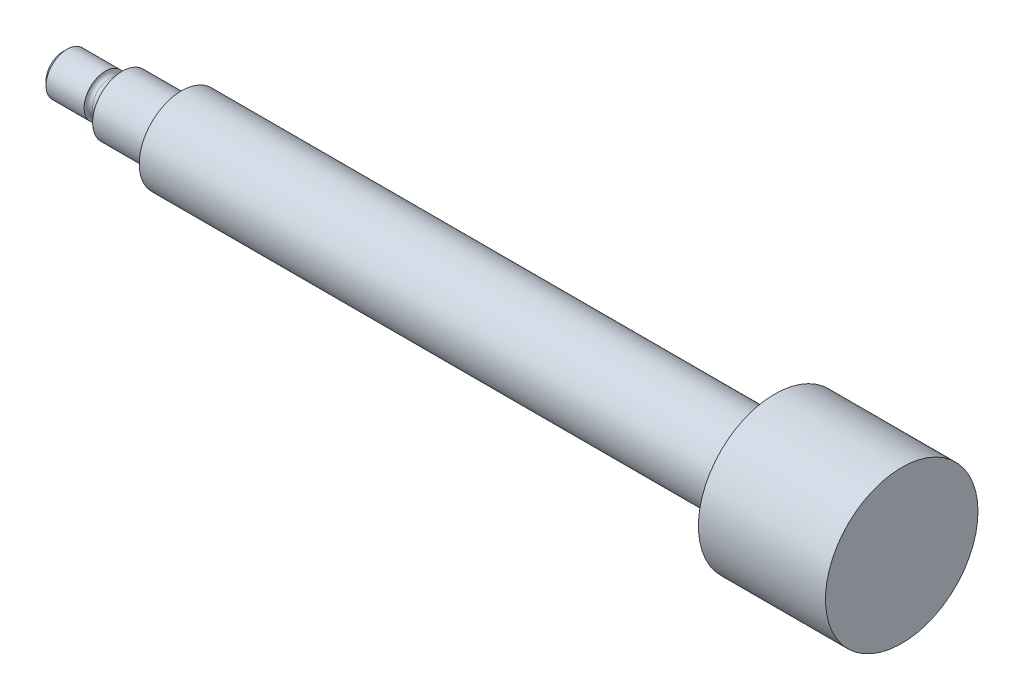
from build123d import *

# Parameters (mm, degrees)
SKETCH1_R           = 5
BOSS_EXTRUDE1_DEPTH = 70
SKETCH3_R           = 3.5
BOSS_EXTRUDE2_DEPTH = 7
SKETCH4_R           = 2.5
BOSS_EXTRUDE3_DEPTH = 7
SKETCH7_OUTSIDE_W   = 29.036
SKETCH7_OUTSIDE_H   = 29.036
SKETCH7_OUTSIDE_R   = 2
CUT_EXTRUDE5_DEPTH  = 2
CHAMFER1_SIZE       = 0.5
FILLET1_R           = 0.5
SKETCH8_R           = 9
BOSS_EXTRUDE4_DEPTH = 15


with BuildPart() as part:
    # Sketch1 → Boss-Extrude1 (new body)
    with BuildSketch(Plane(origin=(0, 0, 0), x_dir=(0, 0, -1), z_dir=(1, 0, 0))):
        Circle(SKETCH1_R)
    extrude(amount=BOSS_EXTRUDE1_DEPTH)

    # Sketch3 → Boss-Extrude2 (add)
    with BuildSketch(Plane.ZY):
        Circle(SKETCH3_R)
    extrude(amount=BOSS_EXTRUDE2_DEPTH)

    # Sketch4 → Boss-Extrude3 (add)
    with BuildSketch(Plane.ZY.offset(7)):
        Circle(SKETCH4_R)
    extrude(amount=BOSS_EXTRUDE3_DEPTH)

    # Sketch7 outside → Cut-Extrude5 (cut)
    with BuildSketch(Plane.ZY.offset(7)):
        Rectangle(SKETCH7_OUTSIDE_W, SKETCH7_OUTSIDE_H)
        Circle(SKETCH7_OUTSIDE_R, mode=Mode.SUBTRACT)
    extrude(amount=CUT_EXTRUDE5_DEPTH, mode=Mode.SUBTRACT)

    # Chamfer1
    chamfer1_edges = [part.edges().sort_by_distance(p)[0] for p in [
        (-14, 0, -2.5),
    ]]
    chamfer(chamfer1_edges, length=CHAMFER1_SIZE)

    # Fillet1
    fillet1_edges = [part.edges().sort_by_distance(p)[0] for p in [
        (-7, 0, -2),
        (-9, 0, -2),
    ]]
    fillet(fillet1_edges, radius=FILLET1_R - 0.0001)  # a hair under: the kernel refuses the full size

    # Sketch8 → Boss-Extrude4 (add)
    with BuildSketch(Plane(origin=(70, 0, 0), x_dir=(0, 0, -1), z_dir=(1, 0, 0))):
        Circle(SKETCH8_R)
    extrude(amount=BOSS_EXTRUDE4_DEPTH)


solid = part.part
